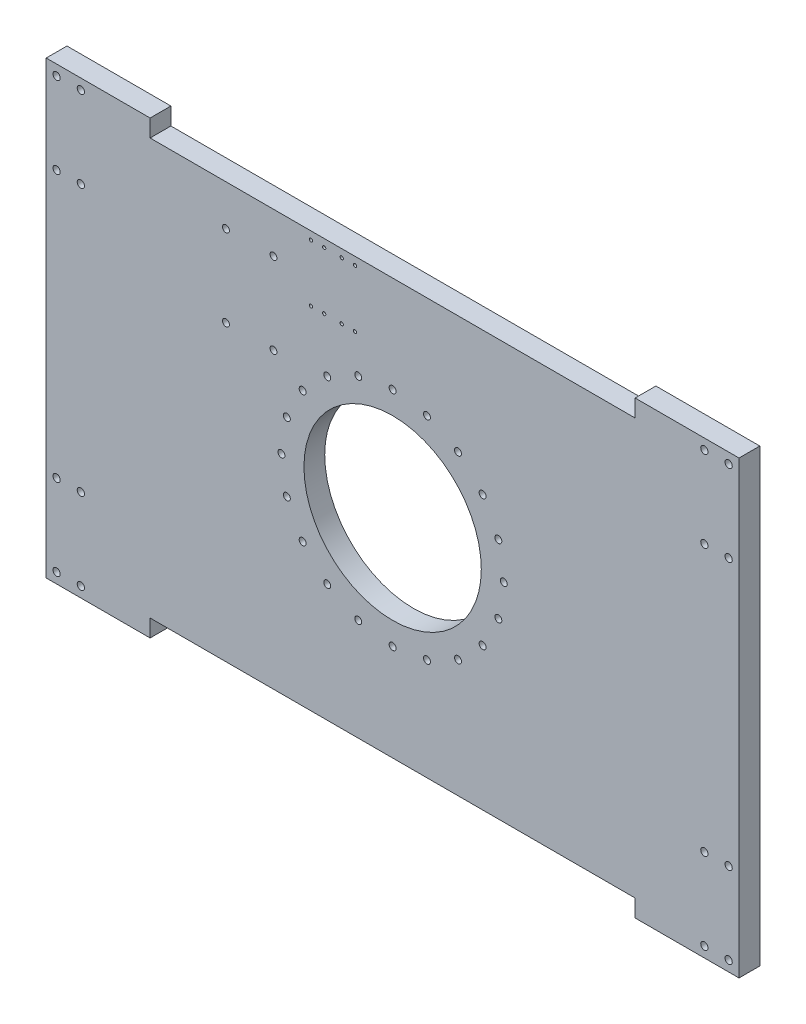
from build123d import *

# Parameters (mm, degrees)
ESQUISSE1_R                  = 10.5
BOSS_EXTRU_1_DEPTH           = 60
ESQUISSE2_R                  = 256
ENL_V_MAT_EXTRU_1_DEPTH      = 1602.905115792
ESQUISSE5_R                  = 10
ENL_V_MAT_EXTRU_3_DEPTH      = 1602.905115792
R_P_TITION_CIRCULAIRE1_COUNT = 20
ENL_V_MAT_EXTRU_5_DEPTH      = 1602.905115792
ENL_V_MAT_EXTRU_5_DEPTH_BACK = 100
ESQUISSE11_R                 = 10
ESQUISSE12_R                 = 4.7625
ESQUISSE12_R_2               = 4.764130996
ENL_V_MAT_EXTRU_6_DEPTH      = 100
ESQUISSE15_R                 = 10.5
ENL_V_MAT_EXTRU_7_DEPTH      = 110
ESQUISSE16_R                 = 10.5
ENL_V_MAT_EXTRU_8_DEPTH      = 110


with BuildPart() as part:
    # Esquisse1 → Boss.-Extru.1 (new body)
    with BuildSketch(Plane.XY):
        Polygon((-1000, 1250), (-700, 1250), (-700, 1200), (700, 1200), (700, 1250), (1000, 1250), (1000, -50), (700, -50), (700, 0), (-700, 0), (-700, -50), (-1000, -50), align=None)
        with Locations((-970, -20)):
            Circle(ESQUISSE1_R, mode=Mode.SUBTRACT)
        with Locations((-970, 215)):
            Circle(ESQUISSE1_R, mode=Mode.SUBTRACT)
        with Locations((-900, 215)):
            Circle(ESQUISSE1_R, mode=Mode.SUBTRACT)
        with Locations((-900, -20)):
            Circle(ESQUISSE1_R, mode=Mode.SUBTRACT)
    extrude(amount=BOSS_EXTRU_1_DEPTH)

    # Esquisse2 → Enlèv. mat.-Extru.1 (cut, through all)
    with BuildSketch(Plane.XY.offset(60)):
        with Locations((0, 600)):
            Circle(ESQUISSE2_R)
    extrude(amount=-ENL_V_MAT_EXTRU_1_DEPTH, mode=Mode.SUBTRACT)

    # Esquisse5 → Enlèv. mat.-Extru.3 (cut, through all)
    with BuildSketch(Plane.XY):
        with Locations((0, 921)):
            Circle(ESQUISSE5_R)
    enl_v_mat_extru_3 = extrude(amount=ENL_V_MAT_EXTRU_3_DEPTH, mode=Mode.SUBTRACT)

    # Répétition circulaire1: Enlèv. mat.-Extru.3 ×20 about axis
    r_p_tition_circulaire1_axis = Axis((0, 600, 0), (0, 0, -1))
    for i in range(1, R_P_TITION_CIRCULAIRE1_COUNT):
        add(enl_v_mat_extru_3.rotate(r_p_tition_circulaire1_axis, i * 360 / R_P_TITION_CIRCULAIRE1_COUNT), mode=Mode.SUBTRACT)

    # Esquisse11 → Enlèv. mat.-Extru.5 (cut, two sides: drawn at the far end of the back side and taken through both)
    with BuildSketch(Plane(origin=(0, 0, 0), x_dir=(-1, 0, 0), z_dir=(0, 0, -1)).offset(-ENL_V_MAT_EXTRU_5_DEPTH_BACK)):
        with Locations((343.85, 847.499999527)):
            Circle(ESQUISSE11_R)
        with Locations((481.15, 847.499999527)):
            Circle(ESQUISSE11_R)
        with Locations((481.15, 1082.5)):
            Circle(ESQUISSE11_R)
        with Locations((343.85, 1082.5)):
            Circle(ESQUISSE11_R)
    extrude(amount=ENL_V_MAT_EXTRU_5_DEPTH + ENL_V_MAT_EXTRU_5_DEPTH_BACK, mode=Mode.SUBTRACT)

    # Esquisse12 → Enlèv. mat.-Extru.6 (cut)
    with BuildSketch(Plane(origin=(0, 0, 0), x_dir=(-1, 0, 0), z_dir=(0, 0, -1))):
        with Locations((108.748120078, 1177.125064527)):
            Circle(ESQUISSE12_R)
        with Locations((197.648120078, 1177.125064527)):
            Circle(ESQUISSE12_R)
        with Locations((108.748120078, 1012.025064527)):
            Circle(ESQUISSE12_R)
        with Locations((146.848120078, 1012.025064527)):
            Circle(ESQUISSE12_R)
        with Locations((197.648120078, 1012.025064527)):
            Circle(ESQUISSE12_R_2)
        with Locations((235.748120078, 1012.025064527)):
            Circle(ESQUISSE12_R)
        with Locations((235.748120078, 1177.125064527)):
            Circle(ESQUISSE12_R)
        with Locations((146.848120078, 1177.125064527)):
            Circle(ESQUISSE12_R)
    extrude(amount=-ENL_V_MAT_EXTRU_6_DEPTH, mode=Mode.SUBTRACT)

    # Esquisse15 → Enlèv. mat.-Extru.7 (cut)
    with BuildSketch(Plane(origin=(0, 0, 0), x_dir=(-1, 0, 0), z_dir=(0, 0, -1))):
        with Locations((970, 1220)):
            Circle(ESQUISSE15_R)
        with Locations((970, 985)):
            Circle(ESQUISSE15_R)
        with Locations((900, 985)):
            Circle(ESQUISSE15_R)
        with Locations((900, 1220)):
            Circle(ESQUISSE15_R)
    enl_v_mat_extru_7 = extrude(amount=-ENL_V_MAT_EXTRU_7_DEPTH, mode=Mode.SUBTRACT)

    # Symétrie1: Enlèv. mat.-Extru.7 across plane
    add(enl_v_mat_extru_7.mirror(Plane(origin=(0, 0, 0), x_dir=(0, 0, 1), z_dir=(1, 0, 0))), mode=Mode.SUBTRACT)

    # Esquisse16 → Enlèv. mat.-Extru.8 (cut)
    with BuildSketch(Plane(origin=(0, 0, 0), x_dir=(-1, 0, 0), z_dir=(0, 0, -1))):
        with Locations((-970, -20)):
            Circle(ESQUISSE16_R)
        with Locations((-900, -20)):
            Circle(ESQUISSE16_R)
        with Locations((-900, 215)):
            Circle(ESQUISSE16_R)
        with Locations((-970, 215)):
            Circle(ESQUISSE16_R)
    extrude(amount=-ENL_V_MAT_EXTRU_8_DEPTH, mode=Mode.SUBTRACT)


solid = part.part
